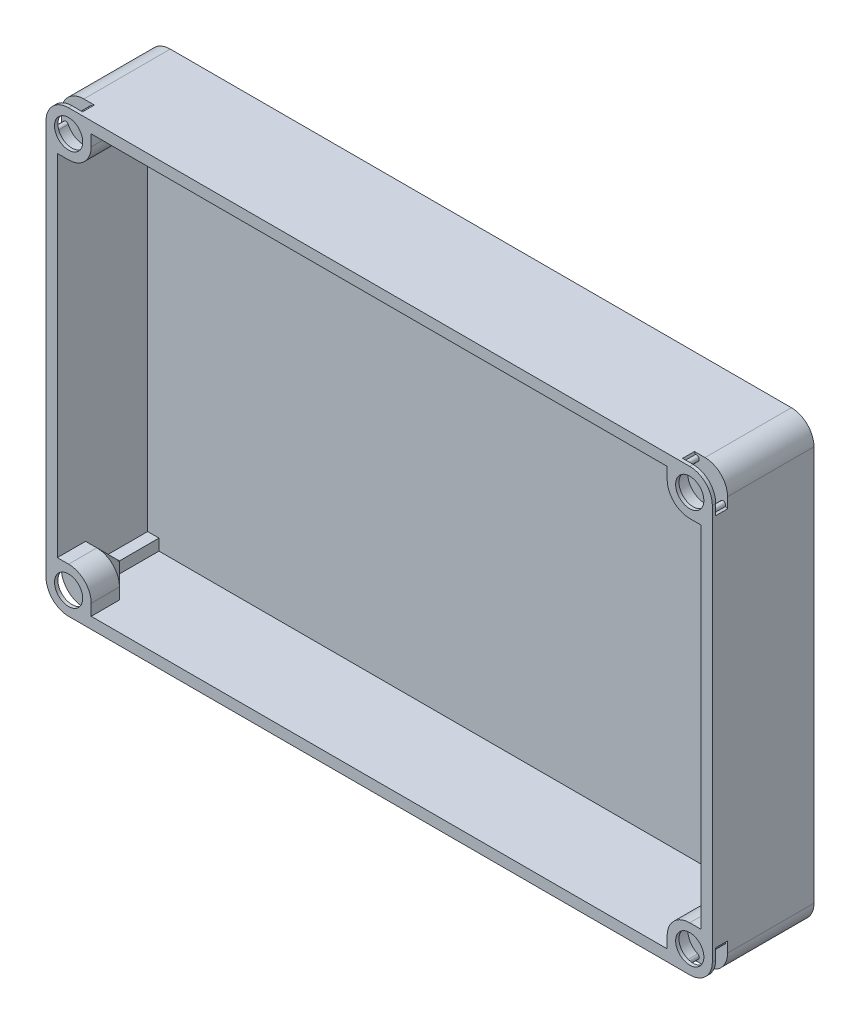
from build123d import *

# Parameters (mm, degrees)
SKETCH_1_W          = 118
SKETCH_1_H          = 78
EXTRUDE_1_DEPTH     = 2
FILLET_1_R          = 4
EXTRUDE_START       = 16
EXTRUDE_4_DEPTH     = 16
EXTRUDE_5_DEPTH     = 9
SKETCH_6_R          = 2.5
CUT_EXTRUDE_1_DEPTH = 0.6
CUT_EXTRUDE_2_DEPTH = 2.1
CHAMFER_1_SIZE      = 4
EXTRUDE_6_DEPTH     = 7


with BuildPart() as part:
    # 草图1 → 凸台-拉伸1 (new body)
    with BuildSketch(Plane.XY):
        Rectangle(SKETCH_1_W, SKETCH_1_H)
    extrude(amount=EXTRUDE_1_DEPTH)

    # 圆角1
    fillet_1_edges = [part.edges().sort_by_distance(p)[0] for p in [
        (59, -39, 1),
        (-59, -39, 1),
        (-59, 39, 1),
        (59, 39, 1),
    ]]
    fillet(fillet_1_edges, radius=FILLET_1_R)

    # 草图4 → 凸台-拉伸4 (add)
    with BuildSketch(Plane.XY.offset(2).offset(EXTRUDE_START)):
        with BuildLine():
            Line((59, -35), (59, 35))
            ThreePointArc((59, 35), (57.828427125, 37.828427125), (55, 39))
            Line((55, 39), (-55, 39))
            ThreePointArc((-55, 39), (-57.828427125, 37.828427125), (-59, 35))
            Line((-59, 35), (-59, -35))
            ThreePointArc((-59, -35), (-57.828427125, -37.828427125), (-55, -39))
            Line((-55, -39), (55, -39))
            ThreePointArc((55, -39), (57.828427125, -37.828427125), (59, -35))
        make_face()
        with BuildLine():
            Line((57, -35), (57, 35))
            ThreePointArc((57, 35), (56.414213562, 36.414213562), (55, 37))
            Line((55, 37), (-55, 37))
            ThreePointArc((-55, 37), (-56.414213562, 36.414213562), (-57, 35))
            Line((-57, 35), (-57, -35))
            ThreePointArc((-57, -35), (-56.414213562, -36.414213562), (-55, -37))
            Line((-55, -37), (55, -37))
            ThreePointArc((55, -37), (56.414213562, -36.414213562), (57, -35))
        make_face(mode=Mode.SUBTRACT)
    extrude(amount=-EXTRUDE_4_DEPTH)

    # 草图5 → 凸台-拉伸5 (add)
    with BuildSketch(Plane.XY.offset(18)):
        with BuildLine():
            Line((-51, 35), (-51, 39))
            Line((-51, 39), (-55, 39))
            ThreePointArc((-55, 39), (-57.828427125, 37.828427125), (-59, 35))
            Line((-59, 35), (-59, 31))
            Line((-59, 31), (-55, 31))
            ThreePointArc((-55, 31), (-52.171572875, 32.171572875), (-51, 35))
        make_face()
        with BuildLine():
            Line((51, 39), (55, 39))
            ThreePointArc((55, 39), (57.828427125, 37.828427125), (59, 35))
            Line((59, 35), (59, 31))
            Line((59, 31), (55, 31))
            ThreePointArc((55, 31), (52.171572875, 32.171572875), (51, 35))
            Line((51, 35), (51, 39))
        make_face()
        with BuildLine():
            Line((51, -35), (51, -39))
            Line((51, -39), (55, -39))
            ThreePointArc((55, -39), (57.828427125, -37.828427125), (59, -35))
            Line((59, -35), (59, -31))
            Line((59, -31), (55, -31))
            ThreePointArc((55, -31), (52.171572875, -32.171572875), (51, -35))
        make_face()
        with BuildLine():
            Line((-51, -39), (-55, -39))
            ThreePointArc((-55, -39), (-57.828427125, -37.828427125), (-59, -35))
            Line((-59, -35), (-59, -31))
            Line((-59, -31), (-55, -31))
            ThreePointArc((-55, -31), (-52.171572875, -32.171572875), (-51, -35))
            Line((-51, -35), (-51, -39))
        make_face()
    extrude(amount=-EXTRUDE_5_DEPTH)

    # 草图6 → 切除-拉伸1 (cut)
    with BuildSketch(Plane.XY.offset(18)):
        with Locations((-55, 35)):
            Circle(SKETCH_6_R)
        with Locations(Location((55, 35, 0), (0, 0, 180))):
            Circle(SKETCH_6_R)
        with Locations((55, -35)):
            Circle(SKETCH_6_R)
        with Locations(Location((-55, -35, 0), (0, 0, 180))):
            Circle(SKETCH_6_R)
    extrude(amount=-CUT_EXTRUDE_1_DEPTH, mode=Mode.SUBTRACT)

    # 草图7 → 切除-拉伸2 (cut)
    with BuildSketch(Plane.XY.offset(17.4)):
        with BuildLine():
            Line((53.309526953, 38.625231148), (52.886908691, 39.531538935))
            ThreePointArc((52.886908691, 39.531538935), (58.535533906, 38.535533906), (59.531538935, 32.886908691))
            Line((59.531538935, 32.886908691), (58.625231148, 33.309526953))
            ThreePointArc((58.625231148, 33.309526953), (58.395478624, 33.940766826), (57.76423875, 33.711014302))
            ThreePointArc((57.76423875, 33.711014302), (52.843324317, 32.843324317), (53.711014302, 37.76423875))
            ThreePointArc((53.711014302, 37.76423875), (53.940766826, 38.395478624), (53.309526953, 38.625231148))
        make_face()
        with BuildLine():
            Line((-58.625231148, 33.309526953), (-59.531538935, 32.886908691))
            ThreePointArc((-59.531538935, 32.886908691), (-58.535533906, 38.535533906), (-52.886908691, 39.531538935))
            Line((-52.886908691, 39.531538935), (-53.309526953, 38.625231148))
            ThreePointArc((-53.309526953, 38.625231148), (-53.940766826, 38.395478624), (-53.711014302, 37.76423875))
            ThreePointArc((-53.711014302, 37.76423875), (-52.843324317, 32.843324317), (-57.76423875, 33.711014302))
            ThreePointArc((-57.76423875, 33.711014302), (-58.395478624, 33.940766826), (-58.625231148, 33.309526953))
        make_face()
        with BuildLine():
            Line((58.625231148, -33.309526953), (59.531538935, -32.886908691))
            ThreePointArc((59.531538935, -32.886908691), (58.535533906, -38.535533906), (52.886908691, -39.531538935))
            Line((52.886908691, -39.531538935), (53.309526953, -38.625231148))
            ThreePointArc((53.309526953, -38.625231148), (53.940766826, -38.395478624), (53.711014302, -37.76423875))
            ThreePointArc((53.711014302, -37.76423875), (52.843324317, -32.843324317), (57.76423875, -33.711014302))
            ThreePointArc((57.76423875, -33.711014302), (58.395478624, -33.940766826), (58.625231148, -33.309526953))
        make_face()
        with BuildLine():
            Line((-53.309526953, -38.625231148), (-52.886908691, -39.531538935))
            ThreePointArc((-52.886908691, -39.531538935), (-58.535533906, -38.535533906), (-59.531538935, -32.886908691))
            Line((-59.531538935, -32.886908691), (-58.625231148, -33.309526953))
            ThreePointArc((-58.625231148, -33.309526953), (-58.395478624, -33.940766826), (-57.76423875, -33.711014302))
            ThreePointArc((-57.76423875, -33.711014302), (-52.843324317, -32.843324317), (-53.711014302, -37.76423875))
            ThreePointArc((-53.711014302, -37.76423875), (-53.940766826, -38.395478624), (-53.309526953, -38.625231148))
        make_face()
    extrude(amount=-CUT_EXTRUDE_2_DEPTH, mode=Mode.SUBTRACT)

    # 倒角1
    chamfer_1_edges = [part.edges().sort_by_distance(p)[0] for p in [
        (-56, 31, 9),
        (-51, 36, 9),
        (-52.171572875, 32.171572875, 9),
        (51, 36, 9),
        (56, 31, 9),
        (52.171572875, 32.171572875, 9),
        (56, -31, 9),
        (51, -36, 9),
        (52.171572875, -32.171572875, 9),
        (-56, -31, 9),
        (-51, -36, 9),
        (-52.171572875, -32.171572875, 9),
    ]]
    chamfer(chamfer_1_edges, length=CHAMFER_1_SIZE - 0.0001)  # a hair under: the kernel refuses the full size

    # 草图8 → 凸台-拉伸6 (add)
    with BuildSketch(Plane(origin=(0, 0, 9), x_dir=(-1, 0, 0), z_dir=(0, 0, -1))):
        with BuildLine():
            Line((-55, -37), (-55, -35))
            Line((-55, -35), (-57, -35))
            ThreePointArc((-57, -35), (-56.414213562, -36.414213562), (-55, -37))
        make_face()
        with BuildLine():
            Line((57, -35), (55, -35))
            Line((55, -35), (55, -37))
            ThreePointArc((55, -37), (56.414213562, -36.414213562), (57, -35))
        make_face()
        with BuildLine():
            Line((55, 37), (55, 35))
            Line((55, 35), (57, 35))
            ThreePointArc((57, 35), (56.414213562, 36.414213562), (55, 37))
        make_face()
        with BuildLine():
            Line((-57, 35), (-55, 35))
            Line((-55, 35), (-55, 37))
            ThreePointArc((-55, 37), (-56.414213562, 36.414213562), (-57, 35))
        make_face()
    extrude(amount=EXTRUDE_6_DEPTH)


solid = part.part
